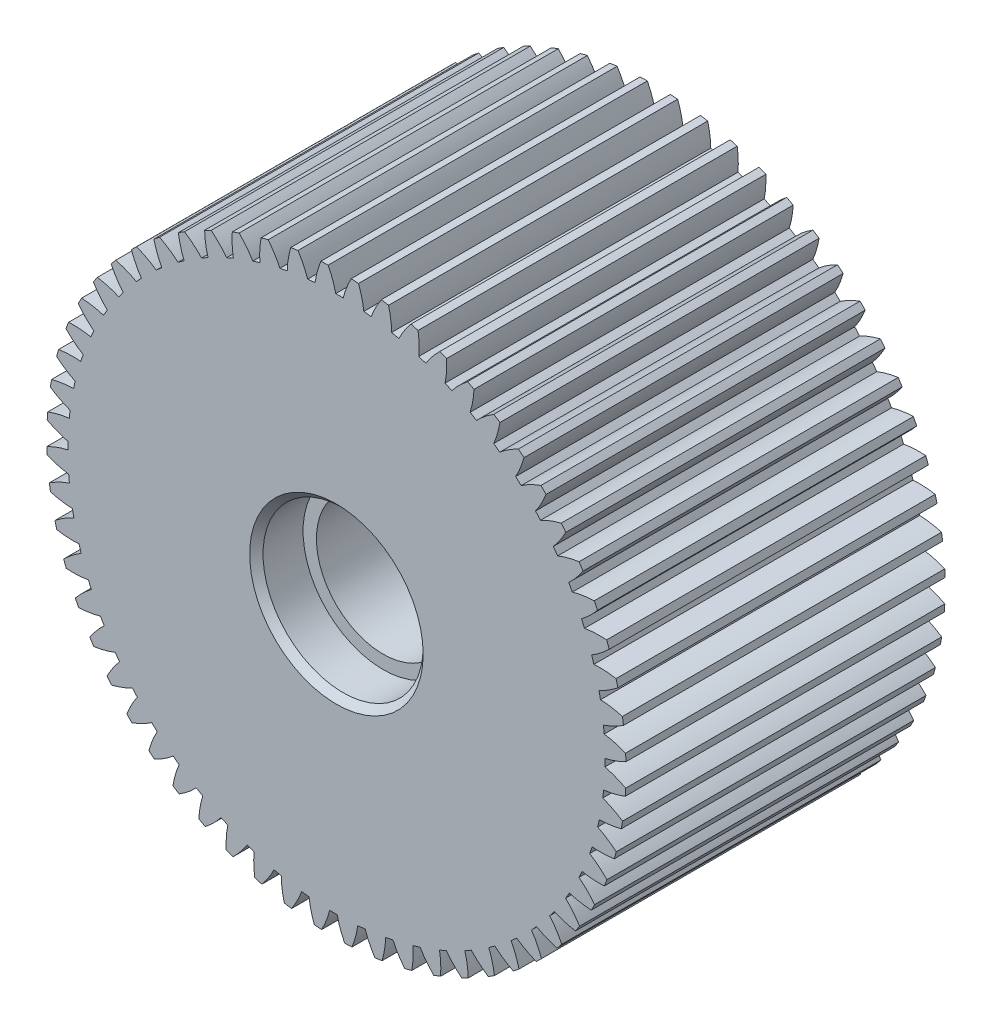
from build123d import *

# Parameters (mm, degrees)
SKETCH1_R               = 21.7
BOSS_EXTRUDE1_DEPTH     = 11.95645654
CUT_EXTRUDE1_DEPTH      = 33.935343523
CIRPATTERN2_COUNT       = 60
CUT_EXTRUDE2_DEPTH      = 39.895338272
CUT_EXTRUDE2_DEPTH_BACK = 39.895338272
SKETCH3_R               = 5
SKETCH4_R               = 6
CUT_EXTRUDE3_DEPTH      = 3.5
CHAMFER1_SIZE           = 0.5


with BuildPart() as part:
    # Sketch1 → Boss-Extrude1 (new, symmetric)
    with BuildSketch(Plane.XY):
        Circle(SKETCH1_R)
    extrude(amount=BOSS_EXTRUDE1_DEPTH, both=True)

    # Sketch2 → Cut-Extrude1 (cut, symmetric)
    with BuildSketch(Plane.XY):
        with BuildLine():
            ThreePointArc((20.124931402, 0.052545874), (20.12498285, 0.02627296), (20.125, 0))
            ThreePointArc((20.125, 0), (20.123720686, -0.226915735), (20.119882907, -0.45380262))
            ThreePointArc((20.119882907, -0.45380262), (20.119273327, -0.480068513), (20.118629459, -0.506333588))
            add(Edge.make_bspline(
                [(20.118629459, -0.506333588), (20.13494912, -0.510029958), (20.184690813, -0.521591327), (20.267550285, -0.542290919), (20.38299225, -0.574201824), (20.514340367, -0.614276081), (20.644736492, -0.657585568), (20.774028418, -0.703727486), (20.929872186, -0.763147469), (21.11563615, -0.839292427), (21.325082956, -0.932735687), (21.499804485, -1.017181236), (21.616587694, -1.076664836), (21.671825098, -1.105439695)],
                knots=[0.078773782, 0.078773782, 0.078773782, 0.078773782, 0.078773782, 0.092110525, 0.119476176, 0.146842496, 0.174208854, 0.201574956, 0.228941013, 0.256307345, 0.307035032, 0.361767352, 0.411345658, 0.411345658, 0.411345658, 0.411345658, 0.411345658], degree=4))
            ThreePointArc((21.671825098, -1.105439695), (21.692955131, -0.552899345), (21.7, 0))
            ThreePointArc((21.7, 0), (21.697810259, 0.308269274), (21.69124148, 0.616476333))
            add(Edge.make_bspline(
                [(20.124931402, 0.052545874), (20.141330263, 0.05587331), (20.191320009, 0.066310104), (20.274625172, 0.085136018), (20.390757349, 0.114435685), (20.522975711, 0.151537959), (20.654315275, 0.191896104), (20.78461479, 0.235110862), (20.941758805, 0.291001584), (21.129192544, 0.362938352), (21.340693166, 0.451634995), (21.517274448, 0.532119242), (21.635369271, 0.58895435), (21.69124148, 0.616476333)],
                knots=[0.078773782, 0.078773782, 0.078773782, 0.078773782, 0.078773782, 0.092110525, 0.119476176, 0.146842496, 0.174208854, 0.201574956, 0.228941013, 0.256307345, 0.307035032, 0.361767352, 0.411345658, 0.411345658, 0.411345658, 0.411345658, 0.411345658], degree=4))
        make_face()
    cut_extrude1 = extrude(amount=CUT_EXTRUDE1_DEPTH, both=True, mode=Mode.SUBTRACT)

    # CirPattern2: Cut-Extrude1 ×60 about axis
    cirpattern2_axis = Axis((0, 0, -11.95645654), (0, 0, 1))
    for i in range(1, CIRPATTERN2_COUNT):
        add(cut_extrude1.rotate(cirpattern2_axis, i * 360 / CIRPATTERN2_COUNT), mode=Mode.SUBTRACT)

    # Sketch3 → Cut-Extrude2 (cut, two sides: drawn at the far end of the back side and taken through both)
    with BuildSketch(Plane.XY.offset(11.95645654).offset(-CUT_EXTRUDE2_DEPTH_BACK)):
        Circle(SKETCH3_R)
    extrude(amount=CUT_EXTRUDE2_DEPTH + CUT_EXTRUDE2_DEPTH_BACK, mode=Mode.SUBTRACT)

    # Sketch4 → Cut-Extrude3 (cut)
    with BuildSketch(Plane.XY.offset(11.95645654)):
        Circle(SKETCH4_R)
    cut_extrude3 = extrude(amount=-CUT_EXTRUDE3_DEPTH, mode=Mode.SUBTRACT)

    # Mirror2: Cut-Extrude3 across plane
    add(cut_extrude3.mirror(Plane.XY), mode=Mode.SUBTRACT)

    # Chamfer1
    chamfer1_edges = [part.edges().sort_by_distance(p)[0] for p in [
        (-6, 0, 11.95645654),
        (-6, 0, -11.95645654),
    ]]
    chamfer(chamfer1_edges, length=CHAMFER1_SIZE)


solid = part.part
